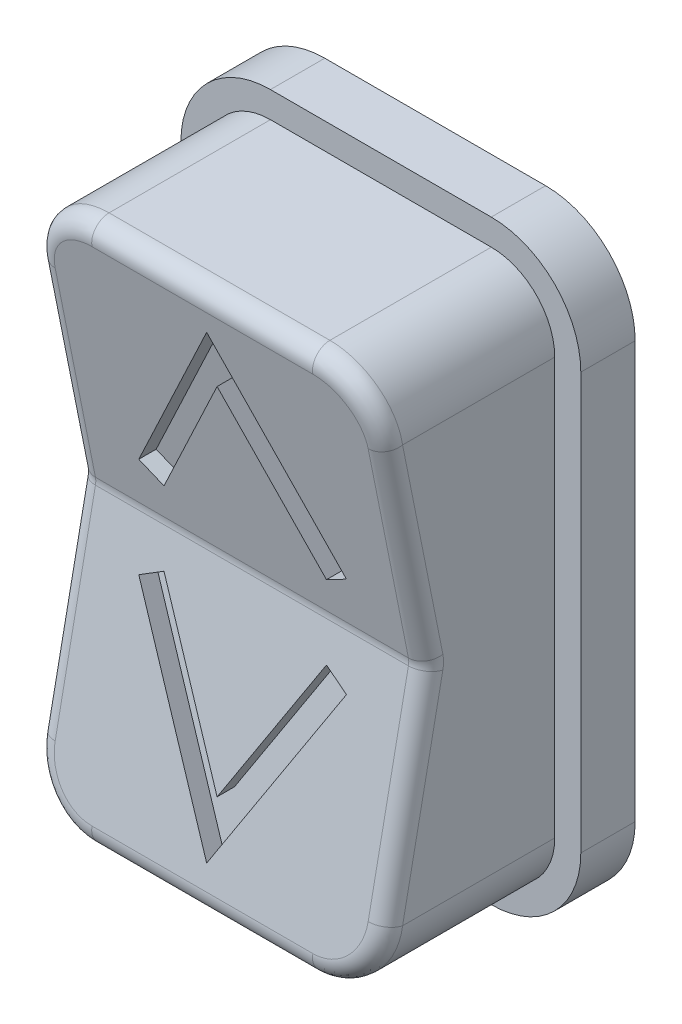
from build123d import *

# Parameters (mm, degrees)
BOSS_EXTRUDE1_DEPTH              = 5.334
CUT_EXTRUDE4_DEPTH               = 11.828751648
CUT_EXTRUDE4_DEPTH_BACK          = 11.828751648
FILLET1_R                        = 0.508
BOSS_EXTRUDE2_DEPTH              = 1.5875
F_56_0_0465_DIAMETER_HOLE1_D     = 1.1811
F_56_0_0465_DIAMETER_HOLE1_DEPTH = 5.08
CUT_EXTRUDE5_REACH               = 15.067
CUT_EXTRUDE6_REACH               = 15.067


with BuildPart() as part:
    # Sketch1 → Boss-Extrude1 (new body)
    with BuildSketch(Plane.XY):
        with BuildLine():
            Line((3.2258, 7.9375), (-3.2258, 7.9375))
            ThreePointArc((-3.2258, 7.9375), (-4.536917394, 7.394417394), (-5.08, 6.0833))
            Line((-5.08, 6.0833), (-5.08, -6.0833))
            ThreePointArc((-5.08, -6.0833), (-4.536917394, -7.394417394), (-3.2258, -7.9375))
            Line((-3.2258, -7.9375), (3.2258, -7.9375))
            ThreePointArc((3.2258, -7.9375), (4.536917394, -7.394417394), (5.08, -6.0833))
            Line((5.08, -6.0833), (5.08, 6.0833))
            ThreePointArc((5.08, 6.0833), (4.536917394, 7.394417394), (3.2258, 7.9375))
        make_face()
    extrude(amount=-BOSS_EXTRUDE1_DEPTH)

    # Sketch11 → Cut-Extrude4 (cut, two sides: drawn at the far end of the back side and taken through both)
    with BuildSketch(Plane(origin=(0, 0, 0), x_dir=(0, 0, -1), z_dir=(1, 0, 0)).offset(-CUT_EXTRUDE4_DEPTH_BACK)):
        Polygon((0, -7.9375), (1.5875, 0), (0, 7.9375), align=None)
    extrude(amount=CUT_EXTRUDE4_DEPTH + CUT_EXTRUDE4_DEPTH_BACK, mode=Mode.SUBTRACT)

    # Fillet1
    fillet1_edges = [part.edges().sort_by_distance(p)[0] for p in [
        (0, -7.9375, 0),
        (-4.543328559, -7.387974724, -0.109905055),
        (-5.08, -3.04165, -0.97917),
        (5.08, -3.04165, -0.97917),
        (4.543328559, -7.387974724, -0.109905055),
        (5.08, 3.04165, -0.97917),
        (0, 0, -1.5875),
        (-5.08, 3.04165, -0.97917),
        (-4.543328559, 7.387974724, -0.109905055),
        (0, 7.9375, 0),
        (4.543328559, 7.387974724, -0.109905055),
    ]]
    fillet(fillet1_edges, radius=FILLET1_R)

    # Sketch4 → Boss-Extrude2 (add)
    with BuildSketch(Plane(origin=(0, 0, -5.334), x_dir=(-1, 0, 0), z_dir=(0, 0, -1))):
        with BuildLine():
            Line((-5.842, 6.0833), (-5.842, -6.0833))
            ThreePointArc((-5.842, -6.0833), (-5.075732761, -7.933232761), (-3.2258, -8.6995))
            Line((-3.2258, -8.6995), (3.2258, -8.6995))
            ThreePointArc((3.2258, -8.6995), (5.075732761, -7.933232761), (5.842, -6.0833))
            Line((5.842, -6.0833), (5.842, 6.0833))
            ThreePointArc((5.842, 6.0833), (5.075732761, 7.933232761), (3.2258, 8.6995))
            Line((3.2258, 8.6995), (-3.2258, 8.6995))
            ThreePointArc((-3.2258, 8.6995), (-5.075732761, 7.933232761), (-5.842, 6.0833))
        make_face()
    extrude(amount=BOSS_EXTRUDE2_DEPTH)

    # #56 (0.0465) Diameter Hole1
    with Locations(Plane(origin=(0, 0, -6.9215), x_dir=(-1, 0, 0), z_dir=(0, 0, -1))):
        with Locations((0, -5.953125), (0, 5.953125)):
            Hole(F_56_0_0465_DIAMETER_HOLE1_D / 2, depth=F_56_0_0465_DIAMETER_HOLE1_DEPTH)

    # Cut-Extrude5: from a plane face, 15.067 long prism both ways, kept between that surface and its translate by the depth
    cut_extrude5_start = Plane(origin=(-5.08, 7.9375, 0), z_dir=(0, 0.1961161351381841, -0.9805806756909202)) * Box(62.268, 62.268, 31.134, align=(Align.CENTER, Align.CENTER, Align.MIN), mode=Mode.PRIVATE)
    cut_extrude5_end = Plane(origin=(-5.08, 7.9375, -0.508), z_dir=(0, 0.1961161351381841, -0.9805806756909202)) * Box(62.268, 62.268, 31.134, align=(Align.CENTER, Align.CENTER, Align.MIN), mode=Mode.PRIVATE)
    # Sketch12 → Cut-Extrude5 (cut, from a surface)
    with BuildSketch(Plane.XY, mode=Mode.PRIVATE) as cut_extrude5_sk1:
        Polygon((0, 6.715125), (3.033759158, 1.4605), (2.373847801, 1.0795), (0, 5.191125), (-2.373847801, 1.0795), (-3.033759158, 1.4605), align=None)
    cut_extrude5_tool1 = extrude(cut_extrude5_sk1.sketch, amount=CUT_EXTRUDE5_REACH, both=True, mode=Mode.PRIVATE)
    add(((cut_extrude5_tool1 & cut_extrude5_start) - cut_extrude5_end).solids().sort_by_distance((0, 4.563993, -0.674701))[0], mode=Mode.SUBTRACT)

    # Cut-Extrude6: from a plane face, 15.067 long prism both ways, kept between that surface and its translate by the depth
    cut_extrude6_start = Plane(origin=(-5.08, -7.9375, 0), z_dir=(0, -0.19611613513818404, -0.9805806756909202)) * Box(62.268, 62.268, 31.134, align=(Align.CENTER, Align.CENTER, Align.MIN), mode=Mode.PRIVATE)
    cut_extrude6_end = Plane(origin=(-5.08, -7.9375, -0.508), z_dir=(0, -0.19611613513818404, -0.9805806756909202)) * Box(62.268, 62.268, 31.134, align=(Align.CENTER, Align.CENTER, Align.MIN), mode=Mode.PRIVATE)
    # Sketch13 → Cut-Extrude6 (cut, from a surface)
    with BuildSketch(Plane.XY, mode=Mode.PRIVATE) as cut_extrude6_sk1:
        Polygon((2.373847801, -1.0795), (3.033759158, -1.4605), (0, -6.715125), (-3.033759158, -1.4605), (-2.373847801, -1.0795), (0, -5.191125), align=None)
    cut_extrude6_tool1 = extrude(cut_extrude6_sk1.sketch, amount=CUT_EXTRUDE6_REACH, both=True, mode=Mode.PRIVATE)
    add(((cut_extrude6_tool1 & cut_extrude6_start) - cut_extrude6_end).solids().sort_by_distance((0, -4.563993, -0.674701))[0], mode=Mode.SUBTRACT)


solid = part.part
